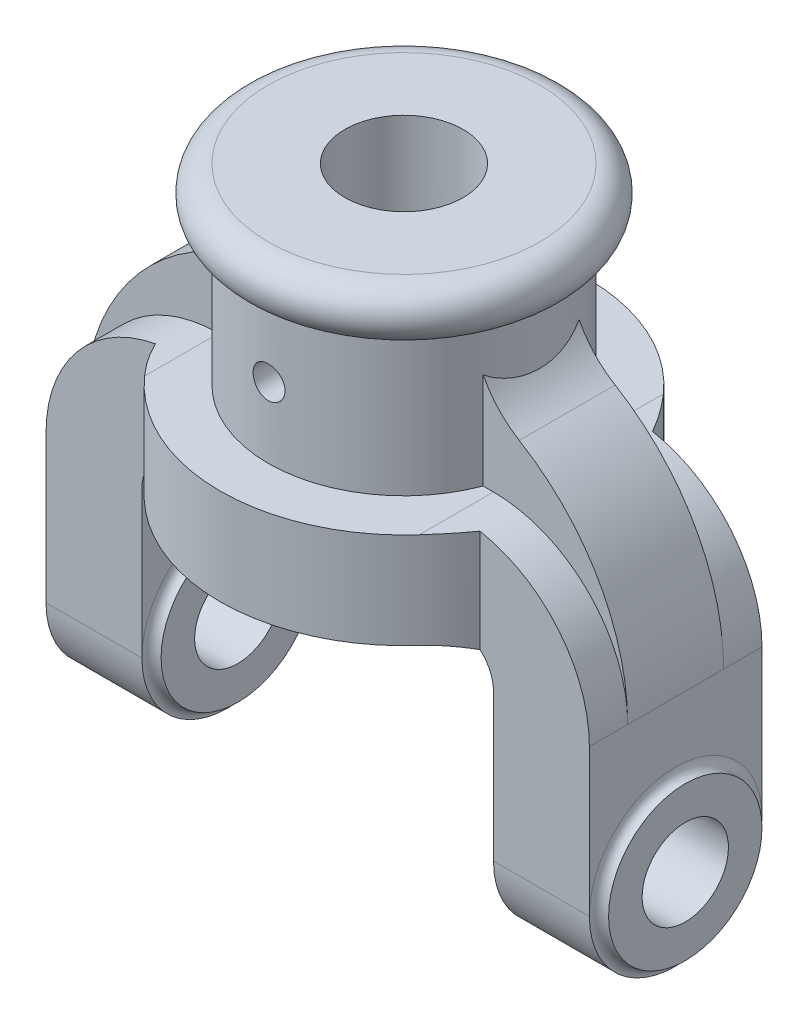
from build123d import *

# Parameters (mm, degrees)
SALIENTE_EXTRUIR1_DEPTH    = 27
REDONDEO1_R                = 42
REDONDEO2_R                = 12
REDONDEO3_R                = 27
CROQUIS3_R                 = 24
SALIENTE_EXTRUIR2_DEPTH    = 3
SALIENTE_EXTRUIR3_START    = 3
CROQUIS4_R                 = 24
SALIENTE_EXTRUIR3_DEPTH    = 3
REDONDEO4_R                = 3
CORTAR_EXTRUIR1_REACH      = 182.49
CROQUIS5_R                 = 13.5
NERVIO1_START              = -15
NERVIO1_DEPTH              = 30
CROQUIS9_R                 = 18.5
CORTAR_EXTRUIR2_DEPTH      = 205.145168964
CORTAR_EXTRUIR3_DEPTH      = 139.384428356
CORTAR_EXTRUIR3_DEPTH_BACK = 139.384428356
CROQUIS10_R                = 5


# Read off the part's stored shape, not the designer's step: Nervio1, Simetría1
with BuildPart() as part:
    # Croquis1 → Revolución1 (revolve)
    with BuildSketch(Plane.XY, mode=Mode.PRIVATE) as revoluci_n1_sk:
        with BuildLine():
            Line((0, 0), (57.5, 0))
            Line((57.5, 0), (57.5, 30))
            Line((57.5, 30), (42.5, 30))
            Line((42.5, 30), (42.5, 74))
            ThreePointArc((42.5, 74), (50.5, 82), (42.5, 90))
            Line((42.5, 90), (0, 90))
            Line((0, 90), (0, 0))
        make_face()
    revolve(revoluci_n1_sk.sketch.rotate(Axis((0, 0, 0), (0, 1, 0)), 90), axis=Axis((0, 0, 0), (0, 1, 0)))

    # Croquis2 → Saliente-Extruir1 (add, symmetric)
    with BuildSketch(Plane.XY):
        Polygon((0, 0), (0, 30), (85, 30), (85, -85), (55, -85), (55, 0), align=None)
    extrude(amount=SALIENTE_EXTRUIR1_DEPTH, both=True)

    # Redondeo1
    redondeo1_edges = [part.edges().sort_by_distance(p)[0] for p in [
        (85, 30, 0),
    ]]
    fillet(redondeo1_edges, radius=REDONDEO1_R)

    # Redondeo2
    redondeo2_edges = [part.edges().sort_by_distance(p)[0] for p in [
        (55, 0, 0),
    ]]
    fillet(redondeo2_edges, radius=REDONDEO2_R)

    # Redondeo3
    redondeo3_edges = [part.edges().sort_by_distance(p)[0] for p in [
        (70, -85, -27),
        (70, -85, 27),
    ]]
    fillet(redondeo3_edges, radius=REDONDEO3_R - 0.0001)  # a hair under: the kernel refuses the full size

    # Croquis3 → Saliente-Extruir2 (add)
    with BuildSketch(Plane(origin=(85, 0, 0), x_dir=(0, 0, -1), z_dir=(1, 0, 0))):
        with Locations(Location((0, -58, 0), (0, 0, 270))):
            Circle(CROQUIS3_R)
    extrude(amount=SALIENTE_EXTRUIR2_DEPTH)

    # Croquis4 → Saliente-Extruir3 (add)
    with BuildSketch(Plane.ZY.offset(-55).offset(SALIENTE_EXTRUIR3_START)):
        with Locations(Location((0, -58, 0), (0, 0, 270))):
            Circle(CROQUIS4_R)
    extrude(amount=-SALIENTE_EXTRUIR3_DEPTH)

    # Redondeo4
    redondeo4_edges = [part.edges().sort_by_distance(p)[0] for p in [
        (85, -34, 0),
        (55, -34, 0),
    ]]
    fillet(redondeo4_edges, radius=REDONDEO4_R - 0.0001)  # a hair under: the kernel refuses the full size

    # Croquis5 → Cortar-Extruir1 (cut, up to next)
    with BuildSketch(Plane(origin=(88, 0, 0), x_dir=(0, 0, -1), z_dir=(1, 0, 0)), mode=Mode.PRIVATE) as cortar_extruir1_sk1:
        with Locations(Location((0, -58, 0), (0, 0, 90))):
            Circle(CROQUIS5_R)
    cortar_extruir1_tool1 = extrude(cortar_extruir1_sk1.sketch, amount=-CORTAR_EXTRUIR1_REACH, mode=Mode.PRIVATE) & part.part
    add(cortar_extruir1_tool1.solids().sort_by_distance((88, -58, 0))[0], mode=Mode.SUBTRACT)

    # Nervio1 outline → Nervio1 (add)
    with BuildSketch(Plane.XY.offset(NERVIO1_START)):
        with BuildLine():
            ThreePointArc((85, -12), (75.925716626, 22.468203515), (51.055512755, 48))
            ThreePointArc((51.055512755, 48), (44.557199454, 53.26513348), (39.764934301, 60.119613841))
            Line((39.764934301, 60.119613841), (38.809047184, 62))
            Line((38.809047184, 62), (38, 62))
            Line((38, 62), (38, 30))
            Line((38, 30), (43, 30))
            ThreePointArc((43, 30), (72.69848481, 17.69848481), (85, -12))
        make_face()
    extrude(amount=NERVIO1_DEPTH)

    # Simetría1
    split(bisect_by=Plane(origin=(0, 0, 0), x_dir=(0, 0, 1), z_dir=(1, 0, 0)), keep=Keep.TOP)

    # Simetr_a1 2: part across plane


with BuildPart() as part_1:
    add(part.part)
    add(part.part.mirror(Plane(origin=(0, 0, 0), x_dir=(0, 0, 1), z_dir=(1, 0, 0))))

    # Croquis9 → Cortar-Extruir2 (cut, through all)
    with BuildSketch(Plane(origin=(0, 90, 0), x_dir=(1, 0, 0), z_dir=(0, 1, 0))):
        with Locations(Location((0, 0, 0), (0, 0, 270))):
            Circle(CROQUIS9_R)
    extrude(amount=-CORTAR_EXTRUIR2_DEPTH, mode=Mode.SUBTRACT)

    # Croquis10 → Cortar-Extruir3 (cut, two sides: drawn at the far end of the back side and taken through both)
    with BuildSketch(Plane.XY.offset(-CORTAR_EXTRUIR3_DEPTH_BACK)):
        with Locations((0, 52)):
            Circle(CROQUIS10_R)
    extrude(amount=CORTAR_EXTRUIR3_DEPTH + CORTAR_EXTRUIR3_DEPTH_BACK, mode=Mode.SUBTRACT)


solid = part_1.part
